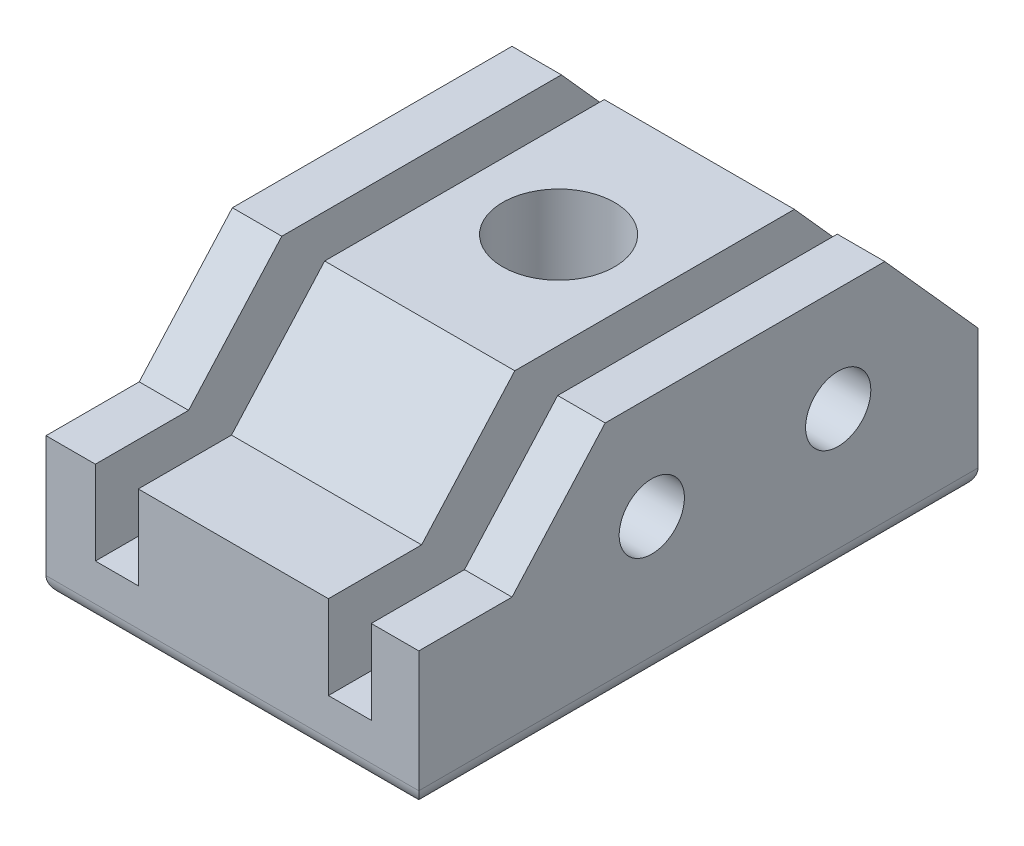
from build123d import *

# Parameters (mm, degrees)
SKETCH1_W           = 63.5
SKETCH1_H           = 6.35
BOSS_EXTRUDE1_DEPTH = 50.8
BOSS_EXTRUDE2_DEPTH = 50.8
SKETCH10_W          = 5.842
SKETCH10_H          = 25.629031657
CUT_EXTRUDE1_DEPTH  = 88.854357354
LPATTERN3_COUNT     = 2
LPATTERN3_PITCH     = 31.75
SKETCH11_R          = 4.445
CUT_EXTRUDE2_DEPTH  = 88.854357354
BOSS_EXTRUDE3_DEPTH = 12.7
SKETCH23_R          = 7.62
CUT_EXTRUDE6_DEPTH  = 88.854357354
FILLET2_R           = 2.54
SKETCH24_R          = 3.175
CUT_EXTRUDE7_DEPTH  = 10


with BuildPart() as part:
    # Sketch1 → Boss-Extrude1 (new body)
    with BuildSketch(Plane(origin=(0, 0, 0), x_dir=(0, 0, -1), z_dir=(1, 0, 0))):
        with Locations((31.75, 3.175)):
            Rectangle(SKETCH1_W, SKETCH1_H)
    extrude(amount=-BOSS_EXTRUDE1_DEPTH)

    # Sketch2 → Boss-Extrude2 (add)
    with BuildSketch(Plane(origin=(0, 0, 0), x_dir=(0, 0, -1), z_dir=(1, 0, 0))):
        Polygon((0, 6.35), (0, 19.05), (12.7, 33.249031657), (50.8, 33.249031657), (63.5, 19.05), (63.5, 6.35), align=None)
    extrude(amount=-BOSS_EXTRUDE2_DEPTH)

    # Sketch10 → Cut-Extrude1 (cut, through all)
    with BuildSketch(Plane(origin=(0, 0, -63.5), x_dir=(-1, 0, 0), z_dir=(0, 0, -1))):
        with Locations((9.398, 20.434515829)):
            Rectangle(SKETCH10_W, SKETCH10_H)
    cut_extrude1 = extrude(amount=-CUT_EXTRUDE1_DEPTH, mode=Mode.SUBTRACT)

    # LPattern3: Cut-Extrude1 ×2
    with Locations(*[(-i * LPATTERN3_PITCH, 0, 0) for i in range(1, LPATTERN3_COUNT)]):
        add(cut_extrude1, mode=Mode.SUBTRACT)

    # Sketch11 → Cut-Extrude2 (cut, through all)
    with BuildSketch(Plane(origin=(0, 0, 0), x_dir=(0, 0, -1), z_dir=(1, 0, 0))):
        with Locations((19.05, 19.05)):
            Circle(SKETCH11_R)
        with Locations((44.45, 19.05)):
            Circle(SKETCH11_R)
    extrude(amount=-CUT_EXTRUDE2_DEPTH, mode=Mode.SUBTRACT)

    # Sketch22 → Boss-Extrude3 (add)
    with BuildSketch(Plane.XY):
        Polygon((0, 0), (-50.8, 0), (-50.8, 7.62), (-50.8, 19.05), (-44.069, 19.05), (-44.069, 7.62), (-38.227, 7.62), (-38.227, 19.05), (-12.319, 19.05), (-12.319, 7.62), (-6.477, 7.62), (-6.477, 19.05), (0, 19.05), (0, 7.62), align=None)
    extrude(amount=BOSS_EXTRUDE3_DEPTH)

    # Sketch23 → Cut-Extrude6 (cut, through all)
    with BuildSketch(Plane(origin=(0, 33.249031657, 0), x_dir=(1, 0, 0), z_dir=(0, 1, 0))):
        with Locations((-25.4, 31.75)):
            Circle(SKETCH23_R)
    extrude(amount=-CUT_EXTRUDE6_DEPTH, mode=Mode.SUBTRACT)

    # Fillet2
    fillet2_edges = [part.edges().sort_by_distance(p)[0] for p in [
        (-25.4, 0, -63.5),
        (-50.8, 0, -25.4),
        (-25.4, 0, 12.7),
        (0, 0, -25.4),
    ]]
    fillet(fillet2_edges, radius=FILLET2_R)

    # Sketch24 → Cut-Extrude7 (cut)
    with BuildSketch(Plane.XZ):
        with Locations((-30.4, -46.15)):
            Circle(SKETCH24_R)
        with Locations((-20.4, -46.15)):
            Circle(SKETCH24_R)
        with Locations((-20.4, 3.35)):
            Circle(SKETCH24_R)
        with Locations((-30.4, 3.35)):
            Circle(SKETCH24_R)
    extrude(amount=-CUT_EXTRUDE7_DEPTH, mode=Mode.SUBTRACT)


solid = part.part
